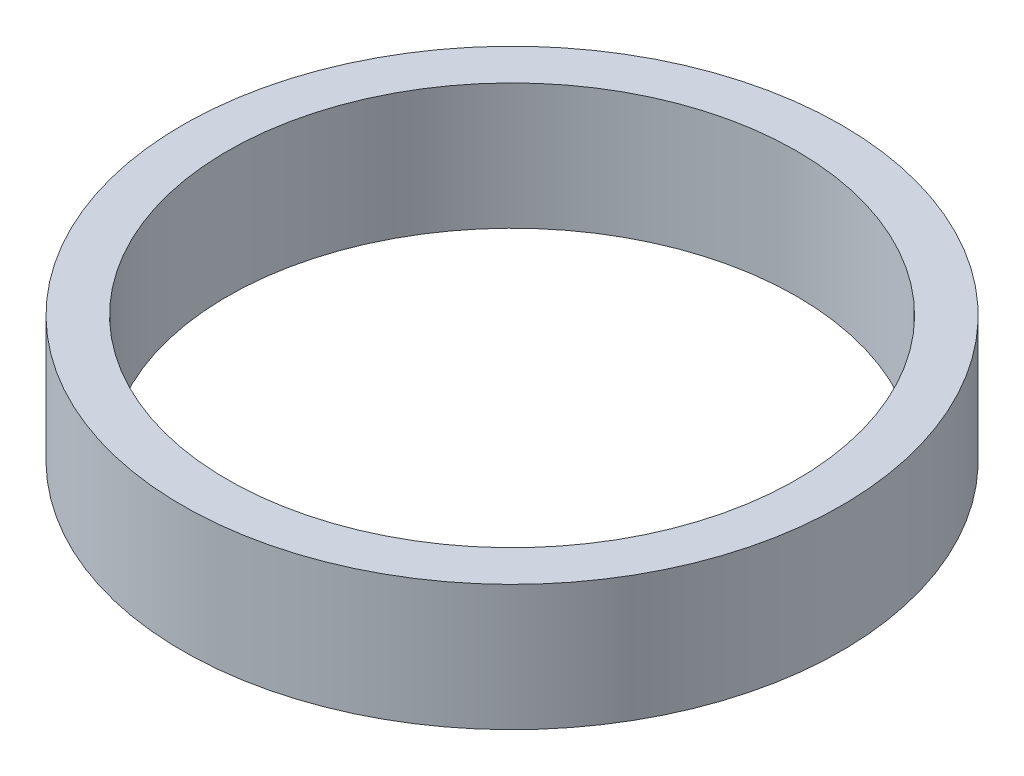
from build123d import *

# Parameters (mm, degrees)
SKETCH1_R           = 55
BOSS_EXTRUDE1_DEPTH = 21
SKETCH2_R           = 47.5
CUT_EXTRUDE1_DEPTH  = 81.566742518


with BuildPart() as part:
    # Sketch1 → Boss-Extrude1 (new body)
    with BuildSketch(Plane(origin=(0, 0, 0), x_dir=(1, 0, 0), z_dir=(0, 1, 0))):
        Circle(SKETCH1_R)
    extrude(amount=BOSS_EXTRUDE1_DEPTH)

    # Sketch2 → Cut-Extrude1 (cut, through all)
    with BuildSketch(Plane(origin=(0, 0, 0), x_dir=(1, 0, 0), z_dir=(0, 1, 0))):
        Circle(SKETCH2_R)
    extrude(amount=CUT_EXTRUDE1_DEPTH, mode=Mode.SUBTRACT)


solid = part.part
